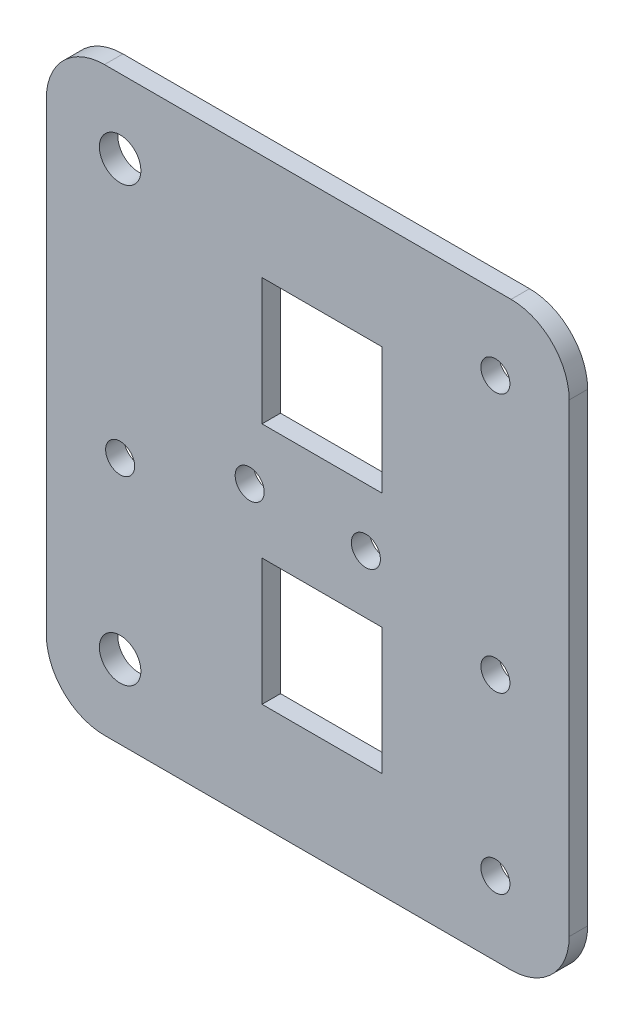
from build123d import *

# Parameters (mm, degrees)
BOSS_EXTRUDE1_START = 19.16
SKETCH1_W           = 90
SKETCH1_H           = 100
SKETCH1_R           = 2.5
SKETCH1_R_2         = 3.57
BOSS_EXTRUDE1_DEPTH = 3.18
FILLET1_R           = 10
SKETCH2_R           = 2.5
CUT_EXTRUDE1_DEPTH  = 10
SKETCH3_W           = 20.620326297
SKETCH3_H           = 21.810990554
CUT_EXTRUDE2_DEPTH  = 72.134467033


with BuildPart() as part:
    # Sketch1 → Boss-Extrude1 (new body)
    with BuildSketch(Plane.XY.offset(BOSS_EXTRUDE1_START)):
        with Locations((0, -5)):
            Rectangle(SKETCH1_W, SKETCH1_H)
        with Locations((32.3, -12.3)):
            Circle(SKETCH1_R, mode=Mode.SUBTRACT)
        with Locations((32.3, -42.3)):
            Circle(SKETCH1_R, mode=Mode.SUBTRACT)
        with Locations((-32.3, -42.3)):
            Circle(SKETCH1_R_2, mode=Mode.SUBTRACT)
        with Locations((-32.3, -12.3)):
            Circle(SKETCH1_R, mode=Mode.SUBTRACT)
        with Locations((-32.3, 32.3)):
            Circle(SKETCH1_R_2, mode=Mode.SUBTRACT)
        with Locations((32.3, 32.3)):
            Circle(SKETCH1_R, mode=Mode.SUBTRACT)
    extrude(amount=-BOSS_EXTRUDE1_DEPTH)

    # Fillet1
    fillet1_edges = [part.edges().sort_by_distance(p)[0] for p in [
        (45, -55, 17.57),
        (-45, -55, 17.57),
        (-45, 45, 17.57),
        (45, 45, 17.57),
    ]]
    fillet(fillet1_edges, radius=FILLET1_R)

    # Sketch2 → Cut-Extrude1 (cut)
    with BuildSketch(Plane.XY.offset(19.16)):
        with Locations((10, -5)):
            Circle(SKETCH2_R)
        with Locations((-10, -5)):
            Circle(SKETCH2_R)
    extrude(amount=-CUT_EXTRUDE1_DEPTH, mode=Mode.SUBTRACT)

    # Sketch3 → Cut-Extrude2 (cut, through all)
    with BuildSketch(Plane(origin=(0, 0, 15.98), x_dir=(-1, 0, 0), z_dir=(0, 0, -1))):
        with Locations((-2.43838742, 15.905495278)):
            Rectangle(SKETCH3_W, SKETCH3_H)
        with Locations((-2.43838742, -25.905495278)):
            Rectangle(SKETCH3_W, SKETCH3_H)
    extrude(amount=-CUT_EXTRUDE2_DEPTH, mode=Mode.SUBTRACT)


solid = part.part
